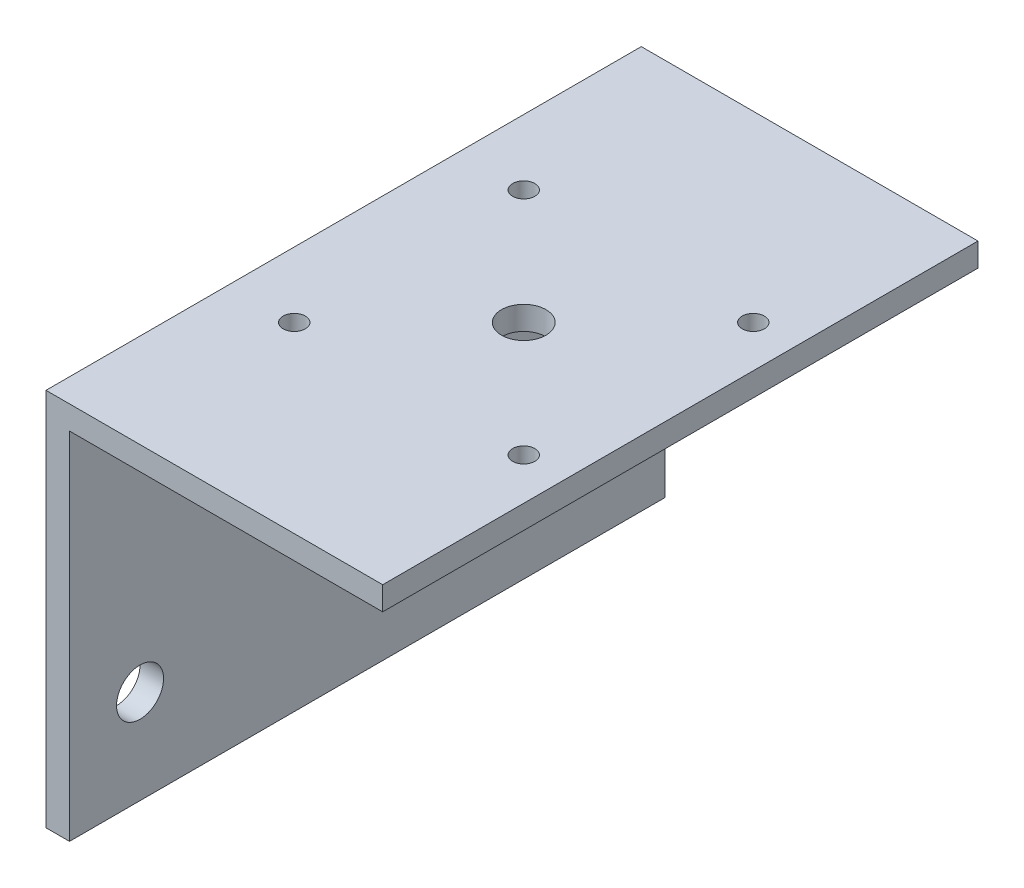
from build123d import *

# Parameters (mm, degrees)
BOSS_EXTRUDE1_DEPTH = 80.4
SKETCH2_R           = 3.175
CUT_EXTRUDE1_DEPTH  = 105.270468614
SKETCH3_R           = 1.5
SKETCH3_R_2         = 3
CUT_EXTRUDE2_DEPTH  = 106.598372383


with BuildPart() as part:
    # Sketch1 → Boss-Extrude1 (new body)
    with BuildSketch(Plane.XY):
        Polygon((0, 0), (3.175, 0), (3.175, 48), (45.475, 48), (45.475, 51.175), (0, 51.175), align=None)
    extrude(amount=BOSS_EXTRUDE1_DEPTH)

    # Sketch2 → Cut-Extrude1 (cut, through all)
    with BuildSketch(Plane(origin=(3.175, 0, 0), x_dir=(0, 0, -1), z_dir=(1, 0, 0))):
        with Locations((-70.875, 12.7)):
            Circle(SKETCH2_R)
        with Locations((-9.525, 12.7)):
            Circle(SKETCH2_R)
    extrude(amount=-CUT_EXTRUDE1_DEPTH, mode=Mode.SUBTRACT)

    # Sketch3 → Cut-Extrude2 (cut, through all)
    with BuildSketch(Plane(origin=(0, 51.175, 0), x_dir=(1, 0, 0), z_dir=(0, 1, 0))):
        with Locations((39.825, -55.7)):
            Circle(SKETCH3_R)
        with Locations((8.825, -55.7)):
            Circle(SKETCH3_R)
        with Locations((8.825, -24.7)):
            Circle(SKETCH3_R)
        with Locations((39.825, -24.7)):
            Circle(SKETCH3_R)
        with Locations((24.325, -40.2)):
            Circle(SKETCH3_R_2)
    extrude(amount=-CUT_EXTRUDE2_DEPTH, mode=Mode.SUBTRACT)


solid = part.part
